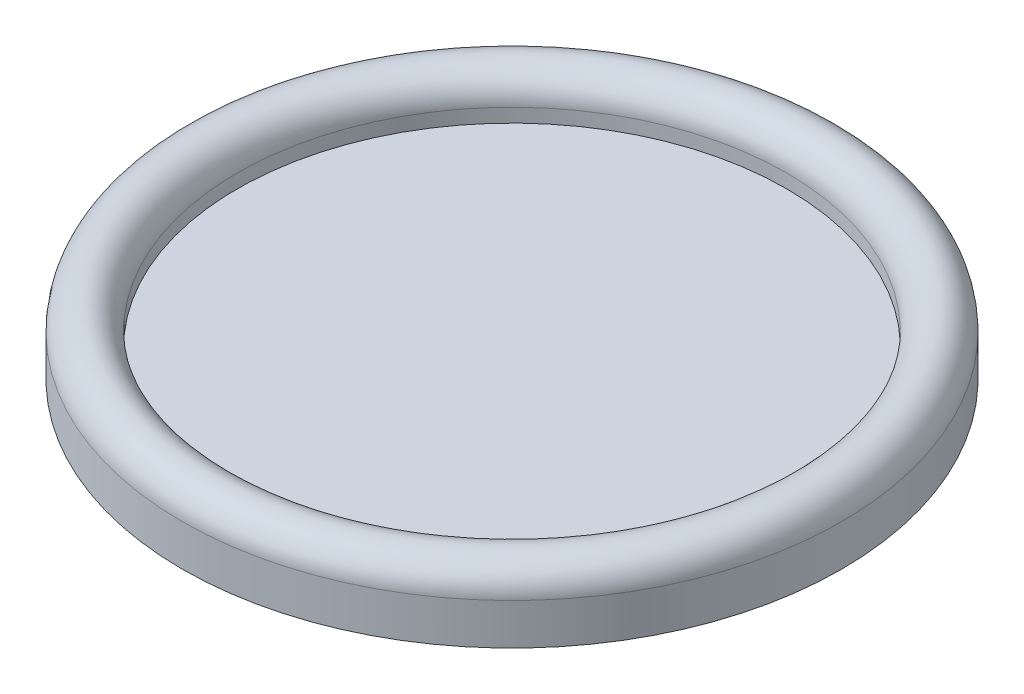
from build123d import *


with BuildPart() as part:
    # Sketch1 → Revolve2 (revolve)
    with BuildSketch(Plane.XY):
        with BuildLine():
            Line((0, -13.577223759), (0, 6.35))
            Line((0, 6.35), (-63.5, 6.35))
            Line((-63.5, 6.35), (-63.5, 9.525))
            ThreePointArc((-63.5, 9.525), (-69.85, 15.875), (-76.2, 9.525))
            Line((-76.2, 9.525), (-76.2, 0))
            ThreePointArc((-76.2, 0), (-38.700067846, -10.156396829), (0, -13.577223759))
        make_face()
    revolve(axis=Axis((0, 6.35, 0), (0, -1, 0)))


solid = part.part
